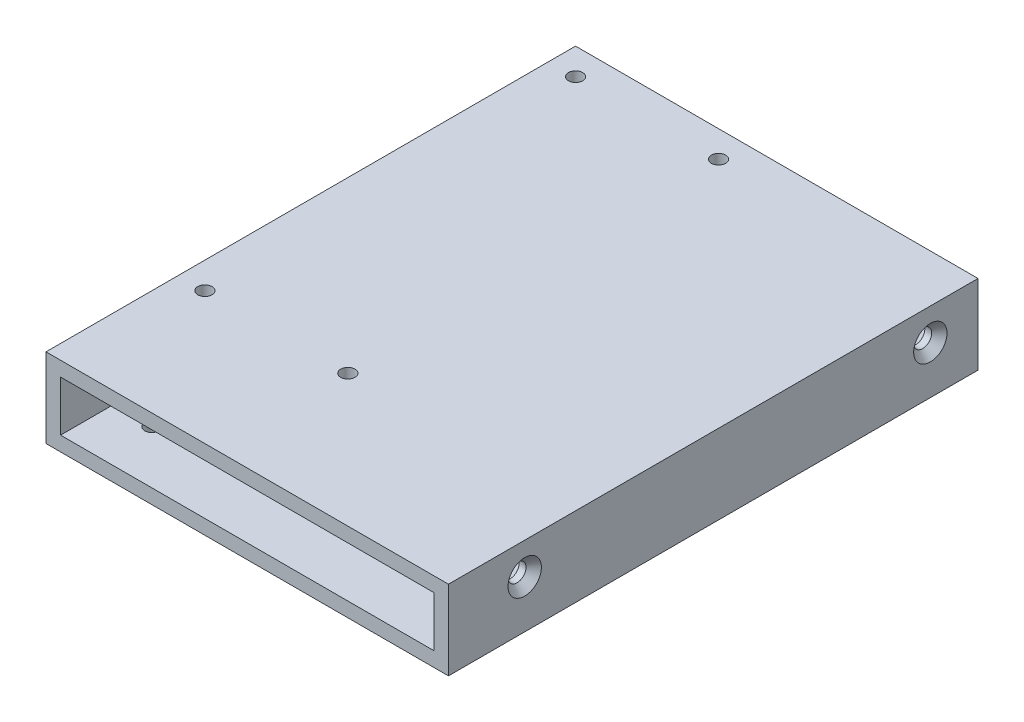
from build123d import *

# Parameters (mm, degrees)
MAIN_SKETCH_W                                  = 76
MAIN_SKETCH_H                                  = 15
MAIN_SKETCH_W_2                                = 70.5
MAIN_SKETCH_H_2                                = 9.5
MAIN_EXTRUSION_DEPTH                           = 100
FRAISAGE_POUR_VIS_T_TE_FRAIS_E_M31_D           = 3.4
FRAISAGE_POUR_VIS_T_TE_FRAIS_E_M31_CSINK_D     = 6.3
FRAISAGE_POUR_VIS_T_TE_FRAIS_E_M31_CSINK_ANGLE = 90
R_P_TITION_LIN_AIRE1_COUNT                     = 2
R_P_TITION_LIN_AIRE1_PITCH                     = 76.6
FRAISAGE_POUR_VIS_T_TE_FRAIS_E_M32_D           = 3.4
FRAISAGE_POUR_VIS_T_TE_FRAIS_E_M32_CSINK_D     = 6.3
FRAISAGE_POUR_VIS_T_TE_FRAIS_E_M32_CSINK_ANGLE = 90
R_P_TITION_LIN_AIRE3_COUNT                     = 2
R_P_TITION_LIN_AIRE3_PITCH                     = 76.5
FRAISAGE_POUR_VIS_T_TE_FRAIS_E_M33_D           = 3.4
FRAISAGE_POUR_VIS_T_TE_FRAIS_E_M33_CSINK_D     = 6.3
FRAISAGE_POUR_VIS_T_TE_FRAIS_E_M33_CSINK_ANGLE = 90
SUPPORT_FIX_HOLE_REACH                         = 128.495
SUPPORT_FIX_SKETCH_R                           = 1.35
ENL_V_MAT_EXTRU_2_REACH                        = 128.495
ESQUISSE12_R                                   = 1.35


with BuildPart() as part:
    # Main-Sketch → Main-Extrusion (new body)
    with BuildSketch(Plane.XY):
        with Locations((38, 7.5)):
            Rectangle(MAIN_SKETCH_W, MAIN_SKETCH_H)
        with Locations((38, 7.5)):
            Rectangle(MAIN_SKETCH_W_2, MAIN_SKETCH_H_2, mode=Mode.SUBTRACT)
    extrude(amount=MAIN_EXTRUSION_DEPTH)

    # Fraisage pour vis à tête fraisée M31 (through all)
    with Locations(Plane.ZY):
        with Locations((9, 9)):
            fraisage_pour_vis_t_te_frais_e_m31 = CounterSinkHole(FRAISAGE_POUR_VIS_T_TE_FRAIS_E_M31_D / 2, FRAISAGE_POUR_VIS_T_TE_FRAIS_E_M31_CSINK_D / 2, counter_sink_angle=FRAISAGE_POUR_VIS_T_TE_FRAIS_E_M31_CSINK_ANGLE)

    # Répétition linéaire1: Fraisage pour vis à tête fraisée M31 ×2
    with Locations(*[(0, 0, i * R_P_TITION_LIN_AIRE1_PITCH) for i in range(1, R_P_TITION_LIN_AIRE1_COUNT)]):
        add(fraisage_pour_vis_t_te_frais_e_m31, mode=Mode.SUBTRACT)

    # Fraisage pour vis à tête fraisée M32 (through all)
    with Locations(Plane(origin=(76, 0, 0), x_dir=(0, 0, -1), z_dir=(1, 0, 0))):
        with Locations((-85.6, 9)):
            fraisage_pour_vis_t_te_frais_e_m32 = CounterSinkHole(FRAISAGE_POUR_VIS_T_TE_FRAIS_E_M32_D / 2, FRAISAGE_POUR_VIS_T_TE_FRAIS_E_M32_CSINK_D / 2, counter_sink_angle=FRAISAGE_POUR_VIS_T_TE_FRAIS_E_M32_CSINK_ANGLE)

    # Répétition linéaire3: Fraisage pour vis à tête fraisée M32 ×2
    with Locations(*[(i * R_P_TITION_LIN_AIRE3_PITCH, 0, 0) for i in range(1, R_P_TITION_LIN_AIRE3_COUNT)]):
        add(fraisage_pour_vis_t_te_frais_e_m32, mode=Mode.SUBTRACT)

    # Fraisage pour vis à tête fraisée M33 (through all)
    with Locations(Plane(origin=(76, 0, 0), x_dir=(0, 0, -1), z_dir=(1, 0, 0))):
        with Locations((-9, 9)):
            CounterSinkHole(FRAISAGE_POUR_VIS_T_TE_FRAIS_E_M33_D / 2, FRAISAGE_POUR_VIS_T_TE_FRAIS_E_M33_CSINK_D / 2, counter_sink_angle=FRAISAGE_POUR_VIS_T_TE_FRAIS_E_M33_CSINK_ANGLE)

    # Support-Fix-Sketch → Support-Fix-Hole (cut, up to next)
    with BuildSketch(Plane.XZ, mode=Mode.PRIVATE) as support_fix_hole_sk1:
        with Locations((66, 90)):
            Circle(SUPPORT_FIX_SKETCH_R)
    support_fix_hole_tool1 = extrude(support_fix_hole_sk1.sketch, amount=-SUPPORT_FIX_HOLE_REACH, mode=Mode.PRIVATE) & part.part
    # Support-Fix-Sketch → Support-Fix-Hole (cut, up to next)
    with BuildSketch(Plane.XZ, mode=Mode.PRIVATE) as support_fix_hole_sk2:
        with Locations((66, 10)):
            Circle(SUPPORT_FIX_SKETCH_R)
    support_fix_hole_tool2 = extrude(support_fix_hole_sk2.sketch, amount=-SUPPORT_FIX_HOLE_REACH, mode=Mode.PRIVATE) & part.part
    # Support-Fix-Sketch → Support-Fix-Hole (cut, up to next)
    with BuildSketch(Plane.XZ, mode=Mode.PRIVATE) as support_fix_hole_sk3:
        with Locations((10, 10)):
            Circle(SUPPORT_FIX_SKETCH_R)
    support_fix_hole_tool3 = extrude(support_fix_hole_sk3.sketch, amount=-SUPPORT_FIX_HOLE_REACH, mode=Mode.PRIVATE) & part.part
    # Support-Fix-Sketch → Support-Fix-Hole (cut, up to next)
    with BuildSketch(Plane.XZ, mode=Mode.PRIVATE) as support_fix_hole_sk4:
        with Locations((10, 90)):
            Circle(SUPPORT_FIX_SKETCH_R)
    support_fix_hole_tool4 = extrude(support_fix_hole_sk4.sketch, amount=-SUPPORT_FIX_HOLE_REACH, mode=Mode.PRIVATE) & part.part
    add(support_fix_hole_tool1.solids().sort_by_distance((66, 0, 90))[0], mode=Mode.SUBTRACT)
    add(support_fix_hole_tool2.solids().sort_by_distance((66, 0, 10))[0], mode=Mode.SUBTRACT)
    add(support_fix_hole_tool3.solids().sort_by_distance((10, 0, 10))[0], mode=Mode.SUBTRACT)
    add(support_fix_hole_tool4.solids().sort_by_distance((10, 0, 90))[0], mode=Mode.SUBTRACT)

    # Esquisse12 → Enlèv. mat.-Extru.2 (cut, up to next)
    with BuildSketch(Plane(origin=(0, 15, 0), x_dir=(1, 0, 0), z_dir=(0, 1, 0)), mode=Mode.PRIVATE) as enl_v_mat_extru_2_sk1:
        with Locations((32, -5)):
            Circle(ESQUISSE12_R)
    enl_v_mat_extru_2_tool1 = extrude(enl_v_mat_extru_2_sk1.sketch, amount=-ENL_V_MAT_EXTRU_2_REACH, mode=Mode.PRIVATE) & part.part
    # Esquisse12 → Enlèv. mat.-Extru.2 (cut, up to next)
    with BuildSketch(Plane(origin=(0, 15, 0), x_dir=(1, 0, 0), z_dir=(0, 1, 0)), mode=Mode.PRIVATE) as enl_v_mat_extru_2_sk2:
        with Locations((5, -5)):
            Circle(ESQUISSE12_R)
    enl_v_mat_extru_2_tool2 = extrude(enl_v_mat_extru_2_sk2.sketch, amount=-ENL_V_MAT_EXTRU_2_REACH, mode=Mode.PRIVATE) & part.part
    # Esquisse12 → Enlèv. mat.-Extru.2 (cut, up to next)
    with BuildSketch(Plane(origin=(0, 15, 0), x_dir=(1, 0, 0), z_dir=(0, 1, 0)), mode=Mode.PRIVATE) as enl_v_mat_extru_2_sk3:
        with Locations((5, -75)):
            Circle(ESQUISSE12_R)
    enl_v_mat_extru_2_tool3 = extrude(enl_v_mat_extru_2_sk3.sketch, amount=-ENL_V_MAT_EXTRU_2_REACH, mode=Mode.PRIVATE) & part.part
    # Esquisse12 → Enlèv. mat.-Extru.2 (cut, up to next)
    with BuildSketch(Plane(origin=(0, 15, 0), x_dir=(1, 0, 0), z_dir=(0, 1, 0)), mode=Mode.PRIVATE) as enl_v_mat_extru_2_sk4:
        with Locations((32, -75)):
            Circle(ESQUISSE12_R)
    enl_v_mat_extru_2_tool4 = extrude(enl_v_mat_extru_2_sk4.sketch, amount=-ENL_V_MAT_EXTRU_2_REACH, mode=Mode.PRIVATE) & part.part
    add(enl_v_mat_extru_2_tool1.solids().sort_by_distance((32, 15, 5))[0], mode=Mode.SUBTRACT)
    add(enl_v_mat_extru_2_tool2.solids().sort_by_distance((5, 15, 5))[0], mode=Mode.SUBTRACT)
    add(enl_v_mat_extru_2_tool3.solids().sort_by_distance((5, 15, 75))[0], mode=Mode.SUBTRACT)
    add(enl_v_mat_extru_2_tool4.solids().sort_by_distance((32, 15, 75))[0], mode=Mode.SUBTRACT)


solid = part.part
